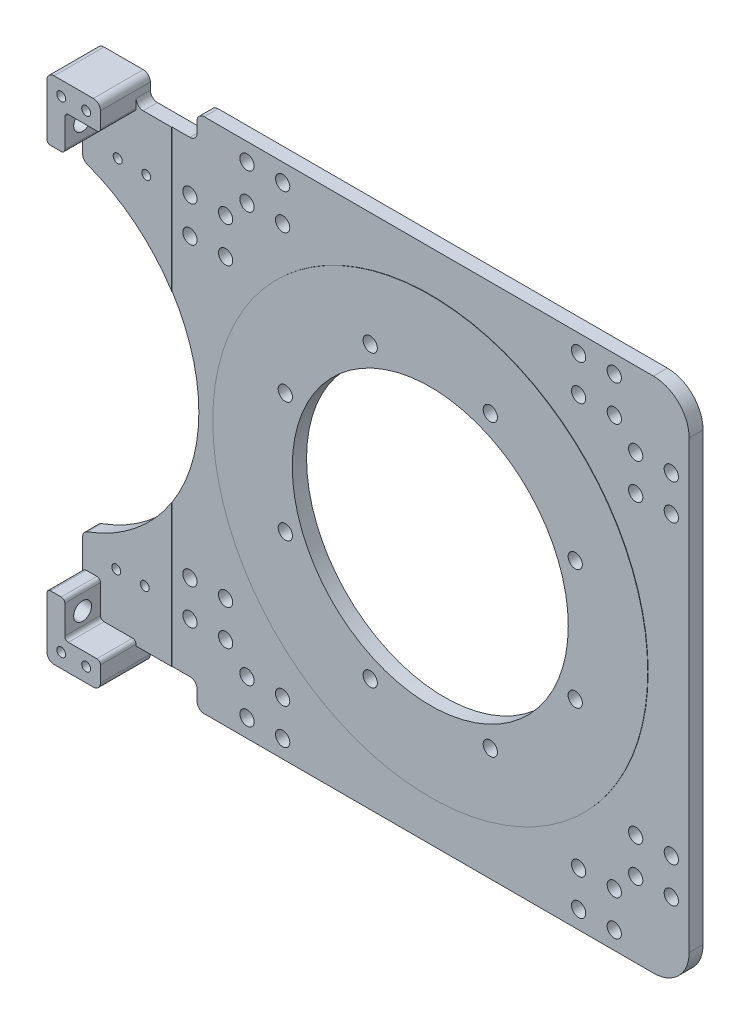
from build123d import *

# Parameters (mm, degrees)
SKETCH_1_W           = 145
SKETCH_1_H           = 145
SKETCH_1_R           = 38.7
SKETCH_1_R_2         = 2
EXTRUDE_1_DEPTH      = 4
SKETCH_2_OUTSIDE_W   = 188.02
SKETCH_2_OUTSIDE_H   = 188.02
SKETCH_2_OUTSIDE_R   = 61
CUT_EXTRUDE_1_DEPTH  = 0.1
SKETCH_3_R           = 1.25
EXTRUDE_2_DEPTH      = 4
SKETCH_5_R           = 2
CUT_EXTRUDE_2_DEPTH  = 4
SKETCH_6_W           = 12
SKETCH_6_H           = 12
CUT_EXTRUDE_3_DEPTH  = 3
FILLET_1_R           = 3
SKETCH_7_R           = 47.5
SKETCH_7_W           = 32
SKETCH_7_H           = 7.011387078
SKETCH_7_H_2         = 7
CUT_EXTRUDE_4_DEPTH  = 4
SKETCH_8_W           = 15
SKETCH_8_H           = 6
EXTRUDE_3_DEPTH      = 4
SKETCH_10_R          = 1.25
EXTRUDE_4_DEPTH      = 10
SKETCH_11_R          = 2.5
CUT_EXTRUDE_5_DEPTH  = 10
FILLET_2_R           = 2
FILLET_3_R           = 1
MIRROR_START         = 4
MIRROR_1_OUTLINE_R   = 1.25
MIRROR_1_DEPTH       = 2.4999999
MIRROR_START_2       = 11.5000001
MIRROR_1_2_OUTLINE_R = 1.25
MIRROR_1_2_DEPTH     = 2.4999999
MIRROR_1_3_OUTLINE_R = 1.25
MIRROR_1_3_DEPTH     = 4
MIRROR_1_4_OUTLINE_R = 1.25
MIRROR_1_4_DEPTH     = 11.5000001
FILLET_4_R           = 10


with BuildPart() as part:
    # 草图1 → 凸台-拉伸1 (new body)
    with BuildSketch(Plane.XY):
        Rectangle(SKETCH_1_W, SKETCH_1_H)
        Circle(SKETCH_1_R, mode=Mode.SUBTRACT)
        with Locations((16.838071024, 40.65069943)):
            Circle(SKETCH_1_R_2, mode=Mode.SUBTRACT)
        with Locations((40.65069943, 16.838071024)):
            Circle(SKETCH_1_R_2, mode=Mode.SUBTRACT)
        with Locations((40.65069943, -16.838071024)):
            Circle(SKETCH_1_R_2, mode=Mode.SUBTRACT)
        with Locations((16.838071024, -40.65069943)):
            Circle(SKETCH_1_R_2, mode=Mode.SUBTRACT)
        with Locations((-16.838071024, -40.65069943)):
            Circle(SKETCH_1_R_2, mode=Mode.SUBTRACT)
        with Locations((-40.65069943, -16.838071024)):
            Circle(SKETCH_1_R_2, mode=Mode.SUBTRACT)
        with Locations((-40.65069943, 16.838071024)):
            Circle(SKETCH_1_R_2, mode=Mode.SUBTRACT)
        with Locations((-16.838071024, 40.65069943)):
            Circle(SKETCH_1_R_2, mode=Mode.SUBTRACT)
    extrude(amount=EXTRUDE_1_DEPTH)

    # 草图2 outside → 切除-拉伸1 (cut)
    with BuildSketch(Plane.XY.offset(4)):
        Rectangle(SKETCH_2_OUTSIDE_W, SKETCH_2_OUTSIDE_H)
        Circle(SKETCH_2_OUTSIDE_R, mode=Mode.SUBTRACT)
    extrude(amount=-CUT_EXTRUDE_1_DEPTH, mode=Mode.SUBTRACT)

    # 草图3 → 凸台-拉伸2 (add)
    # profile 1 of 2: a face of its own
    with BuildSketch(Plane(origin=(0, 0, 0), x_dir=(-1, 0, 0), z_dir=(0, 0, -1))):
        with BuildLine():
            Line((79.5, -72.5), (97.5, -72.5))
            Line((97.5, -72.5), (97.5, -45.069390943))
            ThreePointArc((97.5, -45.069390943), (83.330748854, -37.488728807), (72.5, -25.617376915))
            Line((72.5, -25.617376915), (72.5, -65.5))
            Line((72.5, -65.5), (79.5, -65.5))
            Line((79.5, -65.5), (79.5, -72.5))
        make_face()
        with Locations((80.060949122, -49.683144632)):
            Circle(SKETCH_3_R, mode=Mode.SUBTRACT)
        with Locations((88.060886314, -49.651444241)):
            Circle(SKETCH_3_R, mode=Mode.SUBTRACT)
    # profile 2 of 2: a face of its own
    with BuildSketch(Plane(origin=(0, 0, 0), x_dir=(-1, 0, 0), z_dir=(0, 0, -1))):
        with BuildLine():
            ThreePointArc((72.5, 25.617376915), (83.330748854, 37.488728807), (97.5, 45.069390943))
            Line((97.5, 45.069390943), (97.5, 72.5))
            Line((97.5, 72.5), (79.5, 72.5))
            Line((79.5, 72.5), (79.5, 65.5))
            Line((79.5, 65.5), (72.5, 65.5))
            Line((72.5, 65.5), (72.5, 25.617376915))
        make_face()
        with Locations((79.66469423, 50.316070275)):
            Circle(SKETCH_3_R, mode=Mode.SUBTRACT)
        with Locations((87.664631423, 50.347770667)):
            Circle(SKETCH_3_R, mode=Mode.SUBTRACT)
    extrude(amount=-EXTRUDE_2_DEPTH)

    # 草图5 → 切除-拉伸2 (cut)
    with BuildSketch(Plane(origin=(0, 0, 0), x_dir=(-1, 0, 0), z_dir=(0, 0, -1))):
        with Locations((-67.5, 41.5)):
            Circle(SKETCH_5_R)
        with Locations((-41.5, 67.5)):
            Circle(SKETCH_5_R)
        with Locations((-51.5, 67.5)):
            Circle(SKETCH_5_R)
        with Locations((-51.5, 57.5)):
            Circle(SKETCH_5_R)
        with Locations((-41.5, 57.5)):
            Circle(SKETCH_5_R)
        with Locations((-57.5, 41.5)):
            Circle(SKETCH_5_R)
        with Locations((-57.5, 51.5)):
            Circle(SKETCH_5_R)
        with Locations((-67.5, 51.5)):
            Circle(SKETCH_5_R)
        with Locations(Location((67.5, 51.5, 0), (0, 0, 180))):
            Circle(SKETCH_5_R)
        with Locations(Location((57.5, 51.5, 0), (0, 0, 180))):
            Circle(SKETCH_5_R)
        with Locations(Location((57.5, 41.5, 0), (0, 0, 180))):
            Circle(SKETCH_5_R)
        with Locations(Location((41.5, 57.5, 0), (0, 0, 180))):
            Circle(SKETCH_5_R)
        with Locations(Location((51.5, 57.5, 0), (0, 0, 180))):
            Circle(SKETCH_5_R)
        with Locations(Location((51.5, 67.5, 0), (0, 0, 180))):
            Circle(SKETCH_5_R)
        with Locations(Location((41.5, 67.5, 0), (0, 0, 180))):
            Circle(SKETCH_5_R)
        with Locations(Location((67.5, 41.5, 0), (0, 0, 180))):
            Circle(SKETCH_5_R)
        with Locations((67.5, -41.5)):
            Circle(SKETCH_5_R)
        with Locations((41.5, -67.5)):
            Circle(SKETCH_5_R)
        with Locations((51.5, -67.5)):
            Circle(SKETCH_5_R)
        with Locations((51.5, -57.5)):
            Circle(SKETCH_5_R)
        with Locations((41.5, -57.5)):
            Circle(SKETCH_5_R)
        with Locations((57.5, -41.5)):
            Circle(SKETCH_5_R)
        with Locations((57.5, -51.5)):
            Circle(SKETCH_5_R)
        with Locations((67.5, -51.5)):
            Circle(SKETCH_5_R)
        with Locations(Location((-67.5, -51.5, 0), (0, 0, 180))):
            Circle(SKETCH_5_R)
        with Locations(Location((-57.5, -51.5, 0), (0, 0, 180))):
            Circle(SKETCH_5_R)
        with Locations(Location((-57.5, -41.5, 0), (0, 0, 180))):
            Circle(SKETCH_5_R)
        with Locations(Location((-41.5, -57.5, 0), (0, 0, 180))):
            Circle(SKETCH_5_R)
        with Locations(Location((-51.5, -57.5, 0), (0, 0, 180))):
            Circle(SKETCH_5_R)
        with Locations(Location((-51.5, -67.5, 0), (0, 0, 180))):
            Circle(SKETCH_5_R)
        with Locations(Location((-41.5, -67.5, 0), (0, 0, 180))):
            Circle(SKETCH_5_R)
        with Locations(Location((-67.5, -41.5, 0), (0, 0, 180))):
            Circle(SKETCH_5_R)
    extrude(amount=-CUT_EXTRUDE_2_DEPTH, mode=Mode.SUBTRACT)

    # 草图6 → 切除-拉伸3 (cut)
    with BuildSketch(Plane(origin=(0, 0, 0), x_dir=(-1, 0, 0), z_dir=(0, 0, -1))):
        with BuildLine():
            ThreePointArc((-42, -31.5), (-52.5, 0), (-42, 31.5))
            Line((-42, 31.5), (-65.5, 31.5))
            Line((-65.5, 31.5), (-65.5, -31.5))
            Line((-65.5, -31.5), (-42, -31.5))
        make_face()
        with BuildLine():
            ThreePointArc((-40.233692349, -37.5), (-38.890872965, -38.890872965), (-37.5, -40.233692349))
            Line((-37.5, -40.233692349), (-37.5, -52.5))
            Line((-37.5, -52.5), (-52.5, -52.5))
            Line((-52.5, -52.5), (-52.5, -37.5))
            Line((-52.5, -37.5), (-40.233692349, -37.5))
        make_face()
        with BuildLine():
            ThreePointArc((31.5, -42), (0, -52.5), (-31.5, -42))
            Line((-31.5, -42), (-31.5, -57.5))
            Line((-31.5, -57.5), (-31.5, -65.5))
            Line((-31.5, -65.5), (31.5, -65.5))
            Line((31.5, -65.5), (31.5, -57.5))
            Line((31.5, -57.5), (31.5, -42))
        make_face()
        with BuildLine():
            ThreePointArc((37.5, -40.233692349), (38.890872965, -38.890872965), (40.233692349, -37.5))
            Line((40.233692349, -37.5), (52.5, -37.5))
            Line((52.5, -37.5), (52.5, -52.5))
            Line((52.5, -52.5), (37.5, -52.5))
            Line((37.5, -52.5), (37.5, -40.233692349))
        make_face()
        with BuildLine():
            Line((65.5, 31.5), (42, 31.5))
            ThreePointArc((42, 31.5), (49.805873148, 16.601957716), (52.5, 0))
            ThreePointArc((52.5, 0), (49.805873148, -16.601957716), (42, -31.5))
            Line((42, -31.5), (65.5, -31.5))
            Line((65.5, -31.5), (65.5, 31.5))
        make_face()
        with BuildLine():
            ThreePointArc((40.233692349, 37.5), (38.890872965, 38.890872965), (37.5, 40.233692349))
            Line((37.5, 40.233692349), (37.5, 52.5))
            Line((37.5, 52.5), (52.5, 52.5))
            Line((52.5, 52.5), (52.5, 37.5))
            Line((52.5, 37.5), (40.233692349, 37.5))
        make_face()
        with BuildLine():
            Line((31.5, 57.5), (31.5, 65.5))
            Line((31.5, 65.5), (-31.5, 65.5))
            Line((-31.5, 65.5), (-31.5, 57.5))
            Line((-31.5, 57.5), (-31.5, 42))
            ThreePointArc((-31.5, 42), (0, 52.5), (31.5, 42))
            Line((31.5, 42), (31.5, 57.5))
        make_face()
        with BuildLine():
            ThreePointArc((-37.5, 40.233692349), (-38.890872965, 38.890872965), (-40.233692349, 37.5))
            Line((-40.233692349, 37.5), (-52.5, 37.5))
            Line((-52.5, 37.5), (-52.5, 52.5))
            Line((-52.5, 52.5), (-37.5, 52.5))
            Line((-37.5, 52.5), (-37.5, 40.233692349))
        make_face()
        with Locations((-62.5, 62.5)):
            Rectangle(SKETCH_6_W, SKETCH_6_H)
        with Locations((-62.5, -62.5)):
            Rectangle(SKETCH_6_W, SKETCH_6_H)
    extrude(amount=-CUT_EXTRUDE_3_DEPTH, mode=Mode.SUBTRACT)

    # 圆角1
    fillet_1_edges = [part.edges().sort_by_distance(p)[0] for p in [
        (40.233692349, -37.5, 1.5),
        (37.5, -40.233692349, 1.5),
        (37.5, -52.5, 1.5),
        (52.5, -52.5, 1.5),
        (52.5, -37.5, 1.5),
        (31.5, -42, 1.5),
        (-31.5, -42, 1.5),
        (-31.5, -65.5, 1.5),
        (31.5, -65.5, 1.5),
        (-37.5, -40.233692349, 1.5),
        (-40.233692349, -37.5, 1.5),
        (-52.5, -37.5, 1.5),
        (-52.5, -52.5, 1.5),
        (-37.5, -52.5, 1.5),
        (-42, -31.5, 1.5),
        (-42, 31.5, 1.5),
        (-65.5, 31.5, 1.5),
        (-65.5, -31.5, 1.5),
        (-40.233692349, 37.5, 1.5),
        (-37.5, 40.233692349, 1.5),
        (-37.5, 52.5, 1.5),
        (-52.5, 52.5, 1.5),
        (-52.5, 37.5, 1.5),
        (-31.5, 42, 1.5),
        (31.5, 42, 1.5),
        (31.5, 65.5, 1.5),
        (-31.5, 65.5, 1.5),
        (37.5, 40.233692349, 1.5),
        (40.233692349, 37.5, 1.5),
        (52.5, 37.5, 1.5),
        (52.5, 52.5, 1.5),
        (37.5, 52.5, 1.5),
        (56.5, 68.5, 1.5),
        (56.5, 56.5, 1.5),
        (68.5, 56.5, 1.5),
        (68.5, 68.5, 1.5),
        (68.5, -56.5, 1.5),
        (56.5, -56.5, 1.5),
        (56.5, -68.5, 1.5),
        (68.5, -68.5, 1.5),
        (42, 31.5, 1.5),
        (42, -31.5, 1.5),
        (65.5, -31.5, 1.5),
        (65.5, 31.5, 1.5),
    ]]
    fillet(fillet_1_edges, radius=FILLET_1_R)

    # 草图7 → 切除-拉伸4 (cut)
    with BuildSketch(Plane(origin=(0, 0, 0), x_dir=(-1, 0, 0), z_dir=(0, 0, -1))):
        with Locations((112.5, 0)):
            Circle(SKETCH_7_R)
        with Locations((81.5, 68.994306461)):
            Rectangle(SKETCH_7_W, SKETCH_7_H)
        with Locations((81.5, -69)):
            Rectangle(SKETCH_7_W, SKETCH_7_H_2)
    extrude(amount=-CUT_EXTRUDE_4_DEPTH, mode=Mode.SUBTRACT)

    # 草图8 → 凸台-拉伸3 (add)
    with BuildSketch(Plane(origin=(0, 0, 0), x_dir=(-1, 0, 0), z_dir=(0, 0, -1))):
        with Locations((90, 68.488612922)):
            Rectangle(SKETCH_8_W, SKETCH_8_H)
    extrude(amount=-EXTRUDE_3_DEPTH)

    # 草图10 → 凸台-拉伸4 (add)
    with BuildSketch(Plane.XY.offset(4)):
        Polygon((-97.5, 71.488612922), (-92.400368675, 71.488612922), (-82.5, 71.488612922), (-82.5, 64.088612922), (-92.5, 64.088612922), (-92.5, 54.088612922), (-97.5, 54.088612922), align=None)
        with Locations((-93.5, 67.488612922)):
            Circle(SKETCH_10_R, mode=Mode.SUBTRACT)
        with Locations((-86.5, 67.488612922)):
            Circle(SKETCH_10_R, mode=Mode.SUBTRACT)
    extrude(amount=EXTRUDE_4_DEPTH)

    # 草图11 → 切除-拉伸5 (cut)
    with BuildSketch(Plane(origin=(-92.5, 0, 0), x_dir=(0, 0, -1), z_dir=(1, 0, 0))):
        with Locations(Location((-9, 59.5, 0), (0, 0, 90))):
            Circle(SKETCH_11_R)
    extrude(amount=-CUT_EXTRUDE_5_DEPTH, mode=Mode.SUBTRACT)

    # 圆角2
    fillet_2_edges = [part.edges().sort_by_distance(p)[0] for p in [
        (-97.5, 45.069390943, 2),
        (-65.5, 72.5, 1.95),
        (-65.5, 65.488612922, 1.95),
        (-65.5, -65.5, 1.95),
        (-97.5, -65.5, 2),
        (-65.5, -72.5, 1.95),
        (-65.5, -6.873863542, 1.5),
        (-65.5, 6.873863542, 1.5),
        (-82.5, 65.488612922, 2),
        (-82.5, 71.488612922, 7),
        (-97.5, 71.488612922, 7),
        (-97.5, -45.069390943, 2),
    ]]
    fillet(fillet_2_edges, radius=FILLET_2_R)

    # 圆角3
    fillet_3_edges = [part.edges().sort_by_distance(p)[0] for p in [
        (-97.5, 54.088612922, 9),
        (-92.5, 54.088612922, 9),
        (-92.5, 64.088612922, 9),
        (-82.5, 64.088612922, 9),
    ]]
    fillet(fillet_3_edges, radius=FILLET_3_R)

    # 镜向1: read off the stored shape, not the designer's step
    # 镜向1 outline → 镜向1 (add)
    with BuildSketch(Plane.XY.offset(MIRROR_START)):
        with BuildLine():
            ThreePointArc((-96.5, -54.088612922), (-97.207106781, -54.381506141), (-97.5, -55.088612922))
            Line((-97.5, -55.088612922), (-97.5, -65.488612922))
            Line((-97.5, -65.488612922), (-97.5, -69.488612922))
            ThreePointArc((-97.5, -69.488612922), (-96.914213562, -70.902826485), (-95.5, -71.488612922))
            Line((-95.5, -71.488612922), (-84.5, -71.488612922))
            ThreePointArc((-84.5, -71.488612922), (-83.085786438, -70.902826485), (-82.5, -69.488612922))
            Line((-82.5, -69.488612922), (-82.5, -65.5))
            Line((-82.5, -65.5), (-82.5, -65.088612922))
            ThreePointArc((-82.5, -65.088612922), (-82.792893219, -64.381506141), (-83.5, -64.088612922))
            Line((-83.5, -64.088612922), (-91.5, -64.088612922))
            ThreePointArc((-91.5, -64.088612922), (-92.207106781, -63.795719703), (-92.5, -63.088612922))
            Line((-92.5, -63.088612922), (-92.5, -55.088612922))
            ThreePointArc((-92.5, -55.088612922), (-92.792893219, -54.381506141), (-93.5, -54.088612922))
            Line((-93.5, -54.088612922), (-96.5, -54.088612922))
        make_face()
        with Locations((-93.5, -67.488612922)):
            Circle(MIRROR_1_OUTLINE_R, mode=Mode.SUBTRACT)
        with Locations((-86.5, -67.488612922)):
            Circle(MIRROR_1_OUTLINE_R, mode=Mode.SUBTRACT)
    extrude(amount=MIRROR_1_DEPTH)

    # Mirror 1 3 outline → Mirror 1 3 (add)
    with BuildSketch(Plane.XY):
        with Locations((-93.5, -67.488612922)):
            Circle(MIRROR_1_3_OUTLINE_R)
        with Locations((-86.5, -67.488612922)):
            Circle(MIRROR_1_3_OUTLINE_R)
    extrude(amount=MIRROR_1_3_DEPTH)



with BuildPart() as body_2:
    # Mirror 1 2 outline → Mirror 1 2 (new body)
    with BuildSketch(Plane.XY.offset(MIRROR_START_2)):
        with BuildLine():
            ThreePointArc((-96.5, -54.088612922), (-97.207106781, -54.381506141), (-97.5, -55.088612922))
            Line((-97.5, -55.088612922), (-97.5, -65.488612922))
            Line((-97.5, -65.488612922), (-97.5, -69.488612922))
            ThreePointArc((-97.5, -69.488612922), (-96.914213562, -70.902826485), (-95.5, -71.488612922))
            Line((-95.5, -71.488612922), (-84.5, -71.488612922))
            ThreePointArc((-84.5, -71.488612922), (-83.085786438, -70.902826485), (-82.5, -69.488612922))
            Line((-82.5, -69.488612922), (-82.5, -65.5))
            Line((-82.5, -65.5), (-82.5, -65.088612922))
            ThreePointArc((-82.5, -65.088612922), (-82.792893219, -64.381506141), (-83.5, -64.088612922))
            Line((-83.5, -64.088612922), (-91.5, -64.088612922))
            ThreePointArc((-91.5, -64.088612922), (-92.207106781, -63.795719703), (-92.5, -63.088612922))
            Line((-92.5, -63.088612922), (-92.5, -55.088612922))
            ThreePointArc((-92.5, -55.088612922), (-92.792893219, -54.381506141), (-93.5, -54.088612922))
            Line((-93.5, -54.088612922), (-96.5, -54.088612922))
        make_face()
        with Locations((-93.5, -67.488612922)):
            Circle(MIRROR_1_2_OUTLINE_R, mode=Mode.SUBTRACT)
        with Locations((-86.5, -67.488612922)):
            Circle(MIRROR_1_2_OUTLINE_R, mode=Mode.SUBTRACT)
    extrude(amount=MIRROR_1_2_DEPTH)


with BuildPart() as part_1:
    add(part.part)

    add(body_2.part)  # Mirror 1 4 merges body 2
    # Mirror 1 4 outline → Mirror 1 4 (add)
    with BuildSketch(Plane.XY):
        with BuildLine():
            ThreePointArc((-96.5, -54.088612922), (-97.207106781, -54.381506141), (-97.5, -55.088612922))
            Line((-97.5, -55.088612922), (-97.5, -65.488612922))
            Line((-97.5, -65.488612922), (-97.5, -69.488612922))
            ThreePointArc((-97.5, -69.488612922), (-96.914213562, -70.902826485), (-95.5, -71.488612922))
            Line((-95.5, -71.488612922), (-84.5, -71.488612922))
            ThreePointArc((-84.5, -71.488612922), (-83.085786438, -70.902826485), (-82.5, -69.488612922))
            Line((-82.5, -69.488612922), (-82.5, -65.5))
            Line((-82.5, -65.5), (-82.5, -65.088612922))
            ThreePointArc((-82.5, -65.088612922), (-82.792893219, -64.381506141), (-83.5, -64.088612922))
            Line((-83.5, -64.088612922), (-91.5, -64.088612922))
            ThreePointArc((-91.5, -64.088612922), (-92.207106781, -63.795719703), (-92.5, -63.088612922))
            Line((-92.5, -63.088612922), (-92.5, -55.088612922))
            ThreePointArc((-92.5, -55.088612922), (-92.792893219, -54.381506141), (-93.5, -54.088612922))
            Line((-93.5, -54.088612922), (-96.5, -54.088612922))
        make_face()
        with Locations((-93.5, -67.488612922)):
            Circle(MIRROR_1_4_OUTLINE_R, mode=Mode.SUBTRACT)
        with Locations((-86.5, -67.488612922)):
            Circle(MIRROR_1_4_OUTLINE_R, mode=Mode.SUBTRACT)
    extrude(amount=MIRROR_1_4_DEPTH)

    # Mirror 1 5: loft between two sections, ruled curve by curve
    mirror_1_5_from = [
        Edge.make_three_point_arc((-97.5, -63.5, 0), (-96.9876547, -64.836743616, 0), (-95.713116506, -65.488612922, 0)),
        Edge.make_line((-95.713116506, -65.488612922, 0), (-97.5, -65.488612922, 0)),
        Edge.make_line((-97.5, -65.488612922, 0), (-97.5, -63.5, 0)),
    ]
    mirror_1_5_to = [
        Edge.make_three_point_arc((-97.5, -63.5, 4), (-96.9876547, -64.836743616, 4), (-95.713116506, -65.488612922, 4)),
        Edge.make_line((-95.713116506, -65.488612922, 4), (-97.5, -65.488612922, 4)),
        Edge.make_line((-97.5, -65.488612922, 4), (-97.5, -63.5, 4)),
    ]
    mirror_1_5 = Solid(Shell([*[Face.make_surface_from_curves(mirror_1_5_from[k], mirror_1_5_to[k]) for k in range(3)], Face(Wire(mirror_1_5_from)), Face(Wire(mirror_1_5_to))]))
    add(mirror_1_5, mode=Mode.SUBTRACT)

    # Mirror 1 6: loft between two sections, ruled curve by curve
    mirror_1_6_from = [
        Edge.make_three_point_arc((-97.5, -59.5, 11.5), (-97.5, -62, 9), (-97.5, -59.5, 6.5)),
        Edge.make_three_point_arc((-97.5, -59.5, 6.5), (-97.5, -57, 9), (-97.5, -59.5, 11.5)),
    ]
    mirror_1_6_to = [
        Edge.make_three_point_arc((-92.5, -59.5, 11.5), (-92.5, -62, 9), (-92.5, -59.5, 6.5)),
        Edge.make_three_point_arc((-92.5, -59.5, 6.5), (-92.5, -57, 9), (-92.5, -59.5, 11.5)),
    ]
    mirror_1_6 = Solid(Shell([*[Face.make_surface_from_curves(mirror_1_6_from[k], mirror_1_6_to[k]) for k in range(2)], Face(Wire(mirror_1_6_from)), Face(Wire(mirror_1_6_to))]))
    add(mirror_1_6, mode=Mode.SUBTRACT)

    # 圆角4
    fillet_4_edges = [part_1.edges().sort_by_distance(p)[0] for p in [
        (72.5, -72.5, 1.95),
        (72.5, 72.5, 1.95),
    ]]
    fillet(fillet_4_edges, radius=FILLET_4_R)


solid = part_1.part
